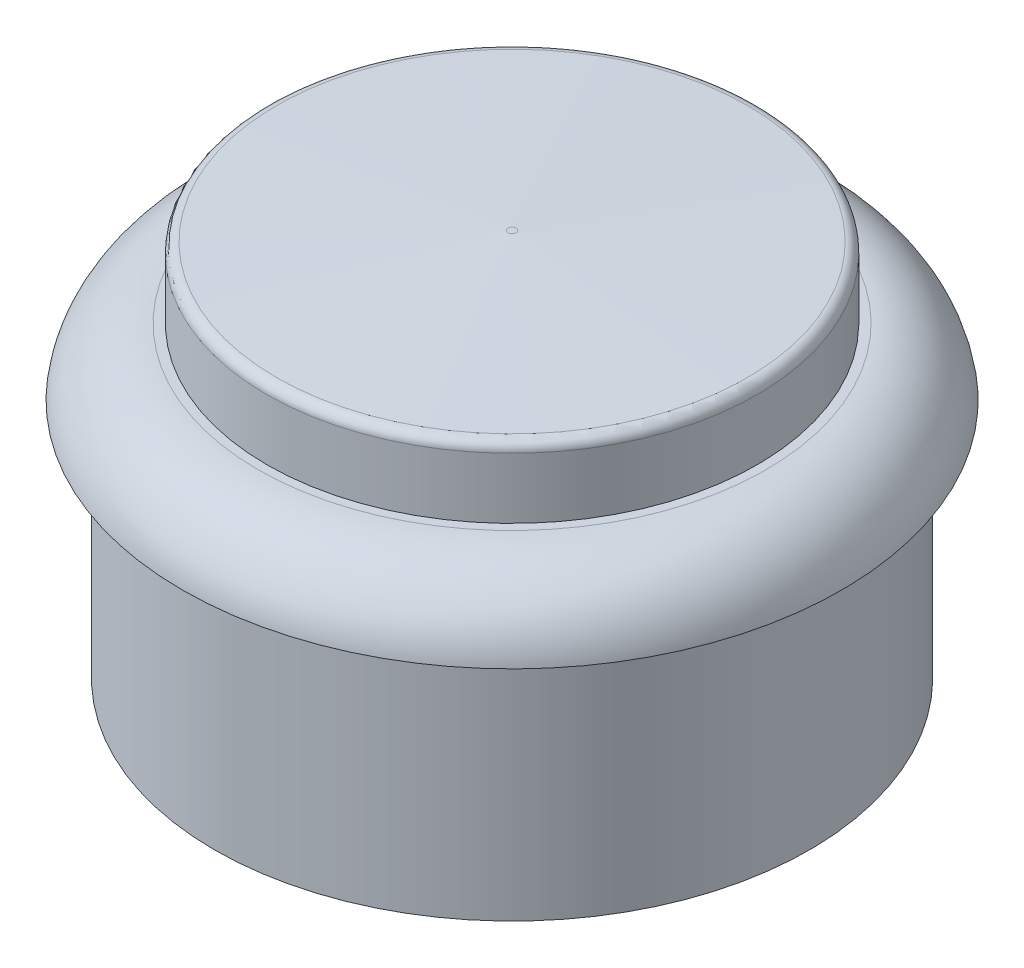
from build123d import *

# Parameters (mm, degrees)
SKETCH1_R           = 14.8
BOSS_EXTRUDE1_DEPTH = 12
SKETCH2_R           = 16.4
BOSS_EXTRUDE2_DEPTH = 3.3
FILLET1_R           = 3.8
SKETCH3_R           = 12.2
BOSS_EXTRUDE3_DEPTH = 4
CHAMFER1_SIZE       = 0.5
CHAMFER1_SIZE2      = 12
FILLET2_R           = 0.5


with BuildPart() as part:
    # Sketch1 → Boss-Extrude1 (new body)
    with BuildSketch(Plane(origin=(0, 0, 0), x_dir=(1, 0, 0), z_dir=(0, 1, 0))):
        with Locations(Location((0, 0, 0), (0, 0, 270))):
            Circle(SKETCH1_R)
    extrude(amount=BOSS_EXTRUDE1_DEPTH)

    # Sketch2 → Boss-Extrude2 (add)
    with BuildSketch(Plane(origin=(0, 12, 0), x_dir=(1, 0, 0), z_dir=(0, 1, 0))):
        with Locations(Location((0, 0, 0), (0, 0, 270))):
            Circle(SKETCH2_R)
    extrude(amount=BOSS_EXTRUDE2_DEPTH)

    # Fillet1
    # the kernel refuses this fillet: 3.8 mm, written as the material it takes off along each edge
    with BuildSketch(Plane(origin=(0, 15.3, 0), x_dir=(0, 0, 1), z_dir=(-1, 0, 0))) as fillet1_piece_1:
        with BuildLine():
            CenterArc((12.63303836, -3.8), FILLET1_R, 7.560843177, 82.439156823)
            Line((12.63303836, 0), (12.63303836, 0.076))
            Line((12.63303836, 0.076), (16.4, 0.076))
            Line((16.4, 0.076), (16.476, 0))
            ThreePointArc((16.476, 0), (16.476, -1.65), (16.475339233, -3.29))
            Line((16.475339233, -3.29), (16.4, -3.3))
        make_face()
    revolve(axis=Axis((0, 15.3, 0), (0, 1, 0)), mode=Mode.SUBTRACT)

    # Sketch3 → Boss-Extrude3 (add)
    with BuildSketch(Plane(origin=(0, 15.3, 0), x_dir=(1, 0, 0), z_dir=(0, 1, 0))):
        with Locations(Location((0, 0, 0), (0, 0, 270))):
            Circle(SKETCH3_R)
    extrude(amount=BOSS_EXTRUDE3_DEPTH)

    # Chamfer1
    chamfer1_edges = [part.edges().sort_by_distance(p)[0] for p in [
        (0, 19.3, -12.2),
    ]]
    chamfer1_side = [part.faces().sort_by_distance(p)[0] for p in [
        (0, 17.3, -12.2),
    ]]
    chamfer(chamfer1_edges, length=CHAMFER1_SIZE, length2=CHAMFER1_SIZE2, reference=chamfer1_side[0])

    # Fillet2
    fillet2_edges = [part.edges().sort_by_distance(p)[0] for p in [
        (0, 18.8, -12.2),
    ]]
    fillet(fillet2_edges, radius=FILLET2_R)


solid = part.part
